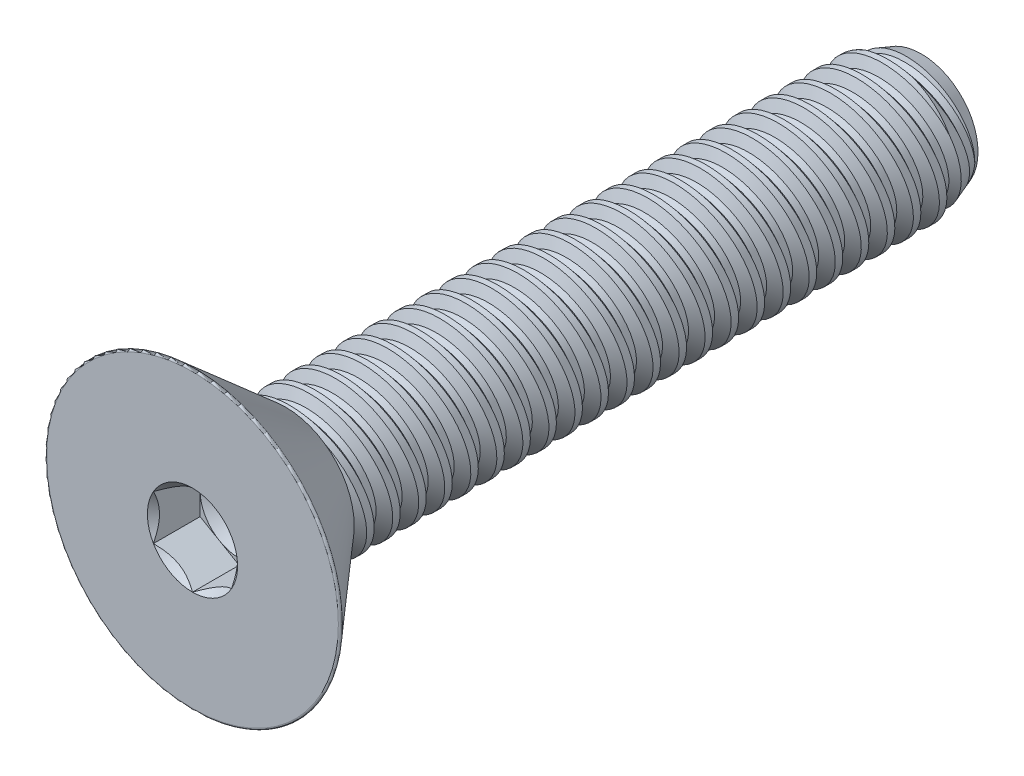
from build123d import *

# Parameters (mm, degrees)
SKETCH1_W          = 19.3802
SKETCH1_H          = 2.0828
LPATTERN1_COUNT    = 24
LPATTERN1_PITCH    = 0.79375
LPATTERN2_COUNT    = 2
LPATTERN2_PITCH    = 0.79375
SKETCH4_R          = 4.5593
EXTRUDE1_DEPTH     = 2.8448
FILLET1_R          = 0.0508
CUT_EXTRUDE1_DEPTH = 1.4224
SKETCH8_R          = 1.190625
CUT_EXTRUDE5_DEPTH = 0.474133333
CUT_EXTRUDE5_DRAFT = -60


with BuildPart() as part:
    # Sketch1 → Revolve1 (revolve)
    with BuildSketch(Plane(origin=(0, 0, 0), x_dir=(0, 0, -1), z_dir=(1, 0, 0)), mode=Mode.PRIVATE) as revolve1_sk:
        with Locations((9.6901, 1.0414)):
            Rectangle(SKETCH1_W, SKETCH1_H)
    revolve(revolve1_sk.sketch.rotate(Axis((0, 0, 0), (0, 0, 1)), 143.466023127), axis=Axis((0, 0, 0), (0, 0, 1)))

    # Sketch2 → Cut-Revolve1 (revolve, cut)
    with BuildSketch(Plane(origin=(0, 0, 0), x_dir=(0, 0, -1), z_dir=(1, 0, 0)), mode=Mode.PRIVATE) as cut_revolve1_sk:
        Polygon((0.097465104, 2.101371857), (0.779720832, 2.231374854), (0.61647657, 1.762908932), (0.421546362, 1.725765218), align=None)
    cut_revolve1 = revolve(cut_revolve1_sk.sketch.rotate(Axis((0, -0.162231854, 0), (0, 0.18718091792156116, -0.9823254572523517)), 180), axis=Axis((0, -0.162231854, 0), (0, 0.18718091792156116, -0.9823254572523517)), mode=Mode.SUBTRACT)

    # Sketch3 → Cut-Revolve2 (revolve, cut)
    with BuildSketch(Plane(origin=(0, 0, 0), x_dir=(0, 0, -1), z_dir=(1, 0, 0)), mode=Mode.PRIVATE) as cut_revolve2_sk:
        Polygon((19.3802, 1.725765218), (18.399255, 2.0828), (19.3802, 2.0828), align=None)
    revolve(cut_revolve2_sk.sketch.rotate(Axis((0, 0, -18.399255), (0, 0, 1)), 143.466023127), axis=Axis((0, 0, -18.399255), (0, 0, 1)), mode=Mode.SUBTRACT)

    # LPattern1: Cut-Revolve1 ×24
    with Locations(*[(0, 0, -i * LPATTERN1_PITCH) for i in range(1, LPATTERN1_COUNT)]):
        add(cut_revolve1, mode=Mode.SUBTRACT)

    # LPattern2: Cut-Revolve1 ×2
    with Locations(*[(0, 0, i * LPATTERN2_PITCH) for i in range(1, LPATTERN2_COUNT)]):
        add(cut_revolve1, mode=Mode.SUBTRACT)

    # Sketch4 → Extrude1 (add)
    with BuildSketch(Plane.XY):
        Circle(SKETCH4_R)
    extrude(amount=EXTRUDE1_DEPTH)

    # Sketch9 → Cut-Revolve3 (revolve, cut)
    with BuildSketch(Plane(origin=(0, 0, 0), x_dir=(0, 0, -1), z_dir=(1, 0, 0)), mode=Mode.PRIVATE) as cut_revolve3_sk:
        Polygon((-2.8448, 4.5593), (0, 2.086353088), (0, 4.5593), align=None)
    revolve(cut_revolve3_sk.sketch.rotate(Axis((0, 0, 0), (0, 0, 1)), 136.412456754), axis=Axis((0, 0, 0), (0, 0, 1)), mode=Mode.SUBTRACT)

    # Fillet1
    fillet1_edges = [part.edges().sort_by_distance(p)[0] for p in [
        (3.143464481, 3.302400271, 2.8448),
    ]]
    fillet(fillet1_edges, radius=FILLET1_R)

    # Sketch6 → Cut-Extrude1 (cut)
    with BuildSketch(Plane.XY.offset(2.8448)):
        Polygon((0, -1.374815329), (1.190625, -0.687407664), (1.190625, 0.687407664), (0, 1.374815329), (-1.190625, 0.687407664), (-1.190625, -0.687407664), align=None)
    extrude(amount=-CUT_EXTRUDE1_DEPTH, mode=Mode.SUBTRACT)

    # Cut-Extrude4 cone 1 section (through the dimple's axis) → Cut-Extrude4 (revolve, cut)
    with BuildSketch(Plane(origin=(0, 0, 2.8448), x_dir=(0, -1, 0), z_dir=(1, 0, 0))):
        Polygon((0, 0), (1.374815329, 0), (0, 1.374815329), align=None)
    revolve(axis=Axis((0, 0, 2.8448), (0, 0, -1)), mode=Mode.SUBTRACT)


with BuildPart() as cut_extrude5_tool:
    # Sketch8 → Cut-Extrude5 (with draft: the straight prism first)
    with BuildSketch(Plane.XY.offset(1.4224)):
        Circle(SKETCH8_R)
    extrude(amount=-CUT_EXTRUDE5_DEPTH)
    # Cut-Extrude5: the draft: its side faces are tilted about the plane it starts from
    cut_extrude5_sides = [cut_extrude5_tool.faces().sort_by_distance(p)[0] for p in [
        (-1.190625, 0, 1.185333333),
    ]]
    draft(cut_extrude5_sides, Plane.XY.offset(1.4224), CUT_EXTRUDE5_DRAFT)


with BuildPart() as part_1:
    add(part.part)

    # Cut-Extrude5: cut by cut_extrude5_tool
    add(cut_extrude5_tool.part, mode=Mode.SUBTRACT)


solid = part_1.part
